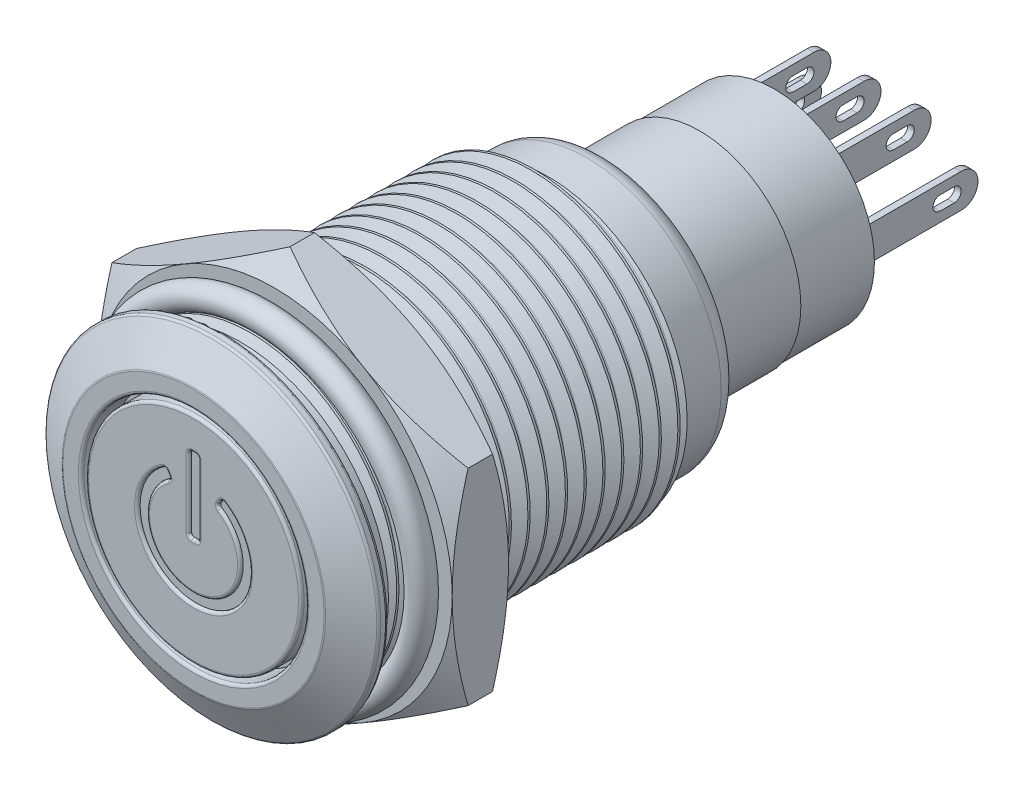
from build123d import *

# Parameters (mm, degrees)
FILLET_1_R          = 0.15
SWEEP_1_PITCH       = 1
SKETCH_4_W          = 1
SKETCH_4_H          = 7.9
EXTRUDE_START       = 2.8
SKETCH_5_R          = 7.5
EXTRUDE_1_DEPTH     = 3
SKETCH_6_W          = 15.345978023
SKETCH_6_H          = 5.674341323
SKETCH_7_R          = 0.65
CUT_EXTRUDE_1_DEPTH = 0.15
FILLET_2_R          = 0.15
SKETCH_9_W          = 0.35
SKETCH_9_H          = 1.8
EXTRUDE_2_DEPTH     = 6.5
EXTRUDE_2_2_DEPTH   = 6.5
EXTRUDE_2_3_DEPTH   = 6.5
EXTRUDE_2_4_DEPTH   = 6.5
EXTRUDE_2_5_DEPTH   = 6.5
SKETCH_10_W         = 1
SKETCH_10_H         = 1.8
CUT_EXTRUDE_2_DEPTH = 41.10181833
CUT_EXTRUDE_3_DEPTH = 41.10181833


with BuildPart() as part:
    # Эскиз1 → Повернуть1 (revolve)
    with BuildSketch(Plane(origin=(0, 0, 0), x_dir=(0, 0, -1), z_dir=(1, 0, 0)), mode=Mode.PRIVATE) as revolve_1_sk:
        with BuildLine():
            Line((-1.5, 5.75), (-1.5, 0))
            Line((-1.5, 0), (29.5, 0))
            Line((29.5, 0), (29.5, 5.325))
            Line((29.5, 5.325), (25.5, 5.325))
            Line((25.5, 5.325), (25.5, 5.4))
            Line((25.5, 5.4), (20.5, 5.4))
            Line((20.5, 5.4), (19.5, 5.4))
            Line((19.5, 5.4), (19.5, 5.9))
            Line((19.5, 5.9), (20.5, 5.9))
            Line((20.5, 5.9), (20.5, 6.15))
            ThreePointArc((20.5, 6.15), (20.207106781, 6.857106781), (19.5, 7.15))
            Line((19.5, 7.15), (17.5, 7.15))
            Line((17.5, 7.15), (17.066987298, 7.9))
            Line((17.066987298, 7.9), (0, 7.9))
            Line((0, 7.9), (0, 8.9))
            Line((0, 8.9), (-0.5, 8.9))
            Line((-0.5, 8.9), (-1.5, 7))
            Line((-1.5, 7), (-1.5, 6))
            Line((-1.5, 6), (0, 6))
            Line((0, 6), (0, 5.75))
            Line((0, 5.75), (-1.5, 5.75))
        make_face()
    revolve(revolve_1_sk.sketch.rotate(Axis((0, 0, 0), (0, 0, -1)), 90), axis=Axis((0, 0, 0), (0, 0, -1)))

    # Скругление1
    fillet_1_edges = [part.edges().sort_by_distance(p)[0] for p in [
        (-5.75, 0, 1.5),
        (-6, 0, 1.5),
        (-7, 0, 1.5),
        (-8.9, 0, 0.5),
        (-8.9, 0, 0),
    ]]
    fillet(fillet_1_edges, radius=FILLET_1_R)

    # Вырез-По траектории1: the profile of Эскиз3 screwed along a left-hand helix of 20 turns, 8 arcs to a turn; built about Z, then put on its axis
    sweep_1_z = Axis((0, 0, 0), (0, 0, 1))
    sweep_1_corners = [(8, 0, 0), (7.288304723, 0.008172928, 0.41081617), (7.238304723, 0.00989549, 0.497401577), (7.288304723, 0.011618052, 0.583986985), (8, 0.01979098, 0.994803155)]
    with BuildLine(mode=Mode.PRIVATE) as sweep_1_profile:
        Line(sweep_1_corners[0], sweep_1_corners[1])
        Line(sweep_1_corners[3], sweep_1_corners[4])
        Line(sweep_1_corners[4], sweep_1_corners[0])
        ThreePointArc((7.288304723, 0.008172928, 0.41081617), (7.251702183, 0.008900968, 0.447411469), (7.238304723, 0.00989549, 0.497401577))
        ThreePointArc((7.238304723, 0.00989549, 0.497401577), (7.251702183, 0.010890012, 0.547391686), (7.288304723, 0.011618052, 0.583986985))
    sweep_1_cap = Face(sweep_1_profile.wire())
    sweep_1_arcs = [((7.288304723, 0.008172928, 0.41081617), (7.238304723, 0.008747115, 0.439677973), (7.238304723, 0.00989549, 0.497401577), (1, 0.8660254037844369, 1)), ((7.238304723, 0.00989549, 0.497401577), (7.238304723, 0.011043865, 0.555125182), (7.288304723, 0.011618052, 0.583986985), (1, 0.8660254037844369, 1))]  # start, shoulder, end, weights
    sweep_1_turn_angles = [0, -22.5, -45, -67.5, -90, -112.5, -135, -157.5, -180, -202.5, -225, -247.5, -270, -292.5, -315, -337.5, -360]
    sweep_1_turn_weights = [1, 0.9238795325112867, 1, 0.9238795325112867, 1, 0.9238795325112867, 1, 0.9238795325112867, 1, 0.9238795325112867, 1, 0.9238795325112867, 1, 0.9238795325112867, 1, 0.9238795325112867, 1]
    sweep_1_turn_rails = [Edge.make_bspline([Vector(p[0], p[1], 0).rotate(sweep_1_z, sweep_1_turn_angles[k]) / sweep_1_turn_weights[k] + Vector(0, 0, p[2] + -SWEEP_1_PITCH * sweep_1_turn_angles[k] / 360) for k in range(17)], [0, 0, 0, 1, 1, 2, 2, 3, 3, 4, 4, 5, 5, 6, 6, 7, 7, 8, 8, 8], 2, sweep_1_turn_weights) for p in sweep_1_corners]
    sweep_1_turn_sides = [*[Face.make_surface_from_curves(sweep_1_turn_rails[p[0]], sweep_1_turn_rails[p[1]]) for p in [(0, 1), (3, 4), (4, 0)]], *[Face.make_bezier_surface([[Vector(p[j][0], p[j][1], 0).rotate(sweep_1_z, sweep_1_turn_angles[2 * i + k]) / sweep_1_turn_weights[2 * i + k] + Vector(0, 0, p[j][2] + -SWEEP_1_PITCH * sweep_1_turn_angles[2 * i + k] / 360) for k in range(3)] for j in range(3)], [[p[3][j] * sweep_1_turn_weights[2 * i + k] for k in range(3)] for j in range(3)]) for p in sweep_1_arcs for i in range(8)]]
    sweep_1 = Plane(origin=(0, 0, 0), x_dir=(-1, 0, 0), z_dir=(0, 0, -1)) * Solid(Shell([*[p.moved(Location((0, 0, SWEEP_1_PITCH * i))) for i in range(20) for p in sweep_1_turn_sides], sweep_1_cap, sweep_1_cap.rotate(sweep_1_z, -7200).moved(Location((0, 0, -SWEEP_1_PITCH * -7200 / 360)))]))
    add(sweep_1, mode=Mode.SUBTRACT)

    # Эскиз4 → Повернуть2 (revolve)
    with BuildSketch(Plane(origin=(0, 0, 0), x_dir=(0, 0, -1), z_dir=(1, 0, 0)), mode=Mode.PRIVATE) as revolve_2_sk:
        with Locations((0.5, 3.95)):
            Rectangle(SKETCH_4_W, SKETCH_4_H)
    revolve(revolve_2_sk.sketch.rotate(Axis((0, 0, 0), (0, 0, 1)), 270), axis=Axis((0, 0, 0), (0, 0, 1)))

    # Эскиз8 → Вырез-Вытянуть1 (cut)
    with BuildSketch(Plane.XY.offset(1.5)):
        Polygon((0, 4), (0, 0), (0.25, 0.433012702), (0.25, 4), align=None)
        Polygon((-0.25, 4), (-0.25, 0.433012702), (0, 0), (0, 4), align=None)
        Polygon((0.25, 0.433012702), (0, 0), (0.25, 0), align=None)
        Polygon((0, 0), (-0.25, 0.433012702), (-0.25, 0), align=None)
        with BuildLine():
            Line((-1.25, 2.165063509), (-1.375, 2.38156986))
            ThreePointArc((-1.375, 2.38156986), (0, -2.75), (1.375, 2.38156986))
            Line((1.375, 2.38156986), (1.25, 2.165063509))
            ThreePointArc((1.25, 2.165063509), (0, -2.5), (-1.25, 2.165063509))
        make_face()
        with BuildLine():
            Line((-1.375, 2.38156986), (-1.5, 2.598076211))
            ThreePointArc((-1.5, 2.598076211), (0, -3), (1.5, 2.598076211))
            Line((1.5, 2.598076211), (1.375, 2.38156986))
            ThreePointArc((1.375, 2.38156986), (0, -2.75), (-1.375, 2.38156986))
        make_face()
    extrude(amount=-CUT_EXTRUDE_1_DEPTH, mode=Mode.SUBTRACT)

    # Скругление2
    fillet_2_edges = [part.edges().sort_by_distance(p)[0] for p in [
        (0.25, 4, 1.425),
        (0, 0, 1.5),
        (0.25, 0, 1.425),
        (-0.25, 2, 1.5),
        (-0.25, 0, 1.425),
        (-0.25, 4, 1.425),
        (0.25, 2, 1.5),
        (0, 4, 1.5),
        (0, -2.5, 1.5),
        (-1.25, 2.165063509, 1.425),
        (1.375, 2.38156986, 1.5),
        (1.25, 2.165063509, 1.425),
        (1.5, 2.598076211, 1.425),
        (-1.375, 2.38156986, 1.5),
        (-1.5, 2.598076211, 1.425),
        (0, -3, 1.5),
    ]]
    fillet(fillet_2_edges, radius=FILLET_2_R - 0.0001)  # a hair under: the kernel refuses the full size


with BuildPart() as body_2:
    # Эскиз5 → Бобышка-Вытянуть1 (new body)
    with BuildSketch(Plane(origin=(0, 0, 0), x_dir=(-1, 0, 0), z_dir=(0, 0, -1)).offset(EXTRUDE_START)):
        Polygon((9.5, -5.484827557), (9.5, 5.484827557), (0, 10.969655115), (-9.5, 5.484827557), (-9.5, -5.484827557), (0, -10.969655115), align=None)
        Circle(SKETCH_5_R, mode=Mode.SUBTRACT)
    extrude(amount=EXTRUDE_1_DEPTH)

    # Эскиз6 → Вырез-Повернуть1 (revolve, cut)
    with BuildSketch(Plane(origin=(0, 0, 0), x_dir=(1, 0, 0), z_dir=(0, 1, 0))):
        with Locations((8.777107623, 4.371971352)):
            Rectangle(SKETCH_6_W, SKETCH_6_H)
        Polygon((8.25, 2.8), (5.651923789, 4.3), (8.25, 5.8), (9.5, 5.8), (12.098076211, 4.3), (9.5, 2.8), align=None, mode=Mode.SUBTRACT)
    revolve(axis=Axis((0, 0, 0), (0, 0, -1)), mode=Mode.SUBTRACT)


with BuildPart() as body_3:
    # Эскиз7 → Повернуть3 (revolve)
    with BuildSketch(Plane(origin=(0, 0, 0), x_dir=(1, 0, 0), z_dir=(0, 1, 0))):
        with Locations((8.5, 2.15)):
            Circle(SKETCH_7_R)
    revolve(axis=Axis((0, 0, 0), (0, 0, -1)))


with BuildPart() as body_4:
    # Эскиз9 → Бобышка-Вытянуть2 (new body)
    with BuildSketch(Plane(origin=(0, 0, -29.5), x_dir=(-1, 0, 0), z_dir=(0, 0, -1))):
        with Locations((-4.175, 0)):
            Rectangle(SKETCH_9_W, SKETCH_9_H)
    extrude(amount=EXTRUDE_2_DEPTH)


with BuildPart() as body_5:
    # Эскиз9 → Extrude 2 2 (new body)
    with BuildSketch(Plane(origin=(0, 0, -29.5), x_dir=(-1, 0, 0), z_dir=(0, 0, -1))):
        with Locations((-2.675, 2.575)):
            Rectangle(SKETCH_9_W, SKETCH_9_H)
    extrude(amount=EXTRUDE_2_2_DEPTH)


with BuildPart() as body_6:
    # Эскиз9 → Extrude 2 3 (new body)
    with BuildSketch(Plane(origin=(0, 0, -29.5), x_dir=(-1, 0, 0), z_dir=(0, 0, -1))):
        with Locations((0, 2.575)):
            Rectangle(SKETCH_9_W, SKETCH_9_H)
    extrude(amount=EXTRUDE_2_3_DEPTH)


with BuildPart() as body_7:
    # Эскиз9 → Extrude 2 4 (new body)
    with BuildSketch(Plane(origin=(0, 0, -29.5), x_dir=(-1, 0, 0), z_dir=(0, 0, -1))):
        with Locations((2.675, 2.575)):
            Rectangle(SKETCH_9_W, SKETCH_9_H)
    extrude(amount=EXTRUDE_2_4_DEPTH)


with BuildPart() as body_8:
    # Эскиз9 → Extrude 2 5 (new body)
    with BuildSketch(Plane(origin=(0, 0, -29.5), x_dir=(-1, 0, 0), z_dir=(0, 0, -1))):
        with Locations((4.175, 0)):
            Rectangle(SKETCH_9_W, SKETCH_9_H)
    extrude(amount=EXTRUDE_2_5_DEPTH)


with BuildPart() as cut_extrude_2_tool:
    # Эскиз10 → Вырез-Вытянуть2 (new, through all)
    with BuildSketch(Plane.ZY.offset(4.35)):
        with Locations((-35.5, 2.575)):
            Rectangle(SKETCH_10_W, SKETCH_10_H)
    extrude(amount=-CUT_EXTRUDE_2_DEPTH)


with BuildPart() as body_5_1:
    add(body_5.part)

    # Вырез-Вытянуть2: cut by cut_extrude_2_tool
    add(cut_extrude_2_tool.part, mode=Mode.SUBTRACT)


with BuildPart() as body_6_1:
    add(body_6.part)

    # Вырез-Вытянуть2: cut by cut_extrude_2_tool
    add(cut_extrude_2_tool.part, mode=Mode.SUBTRACT)


with BuildPart() as body_7_1:
    add(body_7.part)

    # Вырез-Вытянуть2: cut by cut_extrude_2_tool
    add(cut_extrude_2_tool.part, mode=Mode.SUBTRACT)


with BuildPart() as cut_extrude_3_tool:
    # Эскиз11 → Вырез-Вытянуть3 (new, through all)
    with BuildSketch(Plane.ZY.offset(4.35)):
        with BuildLine():
            Line((-34.1, 3.475), (-37, 3.475))
            Line((-37, 3.475), (-37, -0.9))
            Line((-37, -0.9), (-35.1, -0.9))
            ThreePointArc((-35.1, -0.9), (-36, 0), (-35.1, 0.9))
            Line((-35.1, 0.9), (-34.1, 1.675))
            ThreePointArc((-34.1, 1.675), (-35, 2.575), (-34.1, 3.475))
        make_face()
        with BuildLine():
            Line((-32.975, 2.2), (-33.725, 2.2))
            ThreePointArc((-33.725, 2.2), (-34.1, 2.575), (-33.725, 2.95))
            Line((-33.725, 2.95), (-32.975, 2.95))
            ThreePointArc((-32.975, 2.95), (-32.6, 2.575), (-32.975, 2.2))
        make_face()
        with BuildLine():
            Line((-33.975, -0.375), (-34.725, -0.375))
            ThreePointArc((-34.725, -0.375), (-35.1, 0), (-34.725, 0.375))
            Line((-34.725, 0.375), (-33.975, 0.375))
            ThreePointArc((-33.975, 0.375), (-33.6, 0), (-33.975, -0.375))
        make_face()
    extrude(amount=-CUT_EXTRUDE_3_DEPTH)


with BuildPart() as body_4_1:
    add(body_4.part)

    # Вырез-Вытянуть3: cut by cut_extrude_3_tool
    add(cut_extrude_3_tool.part, mode=Mode.SUBTRACT)


with BuildPart() as body_5_2:
    add(body_5_1.part)

    # Вырез-Вытянуть3: cut by cut_extrude_3_tool
    add(cut_extrude_3_tool.part, mode=Mode.SUBTRACT)


with BuildPart() as body_6_2:
    add(body_6_1.part)

    # Вырез-Вытянуть3: cut by cut_extrude_3_tool
    add(cut_extrude_3_tool.part, mode=Mode.SUBTRACT)


with BuildPart() as body_7_2:
    add(body_7_1.part)

    # Вырез-Вытянуть3: cut by cut_extrude_3_tool
    add(cut_extrude_3_tool.part, mode=Mode.SUBTRACT)


with BuildPart() as body_8_1:
    add(body_8.part)

    # Вырез-Вытянуть3: cut by cut_extrude_3_tool
    add(cut_extrude_3_tool.part, mode=Mode.SUBTRACT)


solid = Compound([part.part, body_2.part, body_3.part, body_4_1.part, body_5_2.part, body_6_2.part, body_7_2.part, body_8_1.part])
